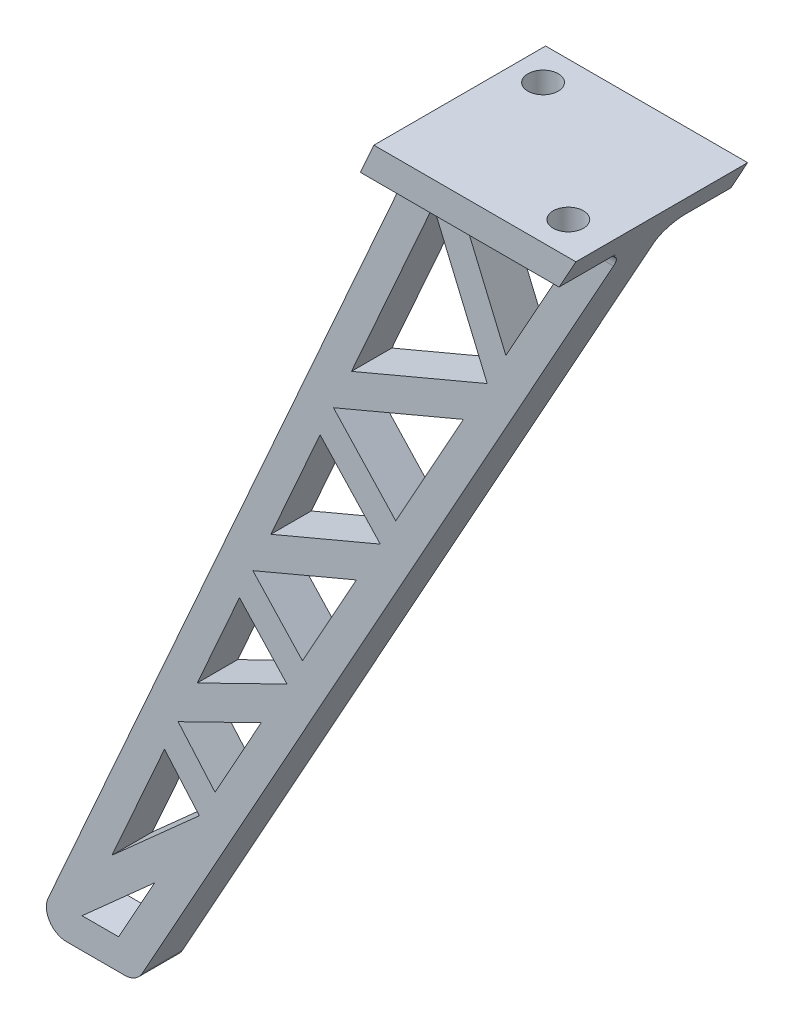
from build123d import *

# Parameters (mm, degrees)
BOSS_EXTRUDE1_DEPTH             = 4
SKETCH2_W                       = 20
SKETCH2_H                       = 17
BOSS_EXTRUDE2_DEPTH             = 3
CUT_EXTRUDE1_DEPTH              = 104.490337713
CUT_EXTRUDE1_DEPTH_BACK         = 104.490337713
BOSS_EXTRUDE3_REACH             = 105.49
BOSS_EXTRUDE3_DIRECTION_2_REACH = 105.49
FILLET2_START                   = -12.222222222
FILLET2_DEPTH                   = 20.555555555
FILLET2_START_2                 = -6.5
FILLET2_2_DEPTH                 = 17
CUT_EXTRUDE2_DEPTH              = 104.490337713
CUT_EXTRUDE2_DEPTH_BACK         = 104.490337713
SKETCH4_R                       = 1.5
FILLET1_R                       = 2
SKETCH8_R                       = 3.25
CUT_EXTRUDE5_DEPTH              = 2


with BuildPart() as part:
    # Sketch1 → Boss-Extrude1 (new body)
    with BuildSketch(Plane.XY):
        Polygon((-10, 0), (10, 0), (-40, -90), (-50, -90), align=None)
        Polygon((-8.939269622, -5), (3.790345509, -5), (-3.431876714, -18), align=None, mode=Mode.SUBTRACT)
        Polygon((-10.607355622, -8.753193502), (-18.717047399, -27), (-5.280384607, -21.327314208), align=None, mode=Mode.SUBTRACT)
        Polygon((-7.643825511, -25.581507835), (-14.336143532, -37.627680274), (-20.498621264, -31.008541196), align=None, mode=Mode.SUBTRACT)
        Polygon((-21.823082205, -33.988578312), (-26.698028096, -44.957206566), (-15.867976064, -40.384978831), align=None, mode=Mode.SUBTRACT)
        Polygon((-18.231416968, -44.639172459), (-23.566710848, -54.242701442), (-28.47960196, -48.965747762), align=None, mode=Mode.SUBTRACT)
        Polygon((-29.804062901, -51.945784878), (-33.981685193, -61.345435036), (-25.09854338, -57), align=None, mode=Mode.SUBTRACT)
        Polygon((-45.383714066, -87), (-41.765210047, -87), (-38.207091023, -80.595385758), align=None, mode=Mode.SUBTRACT)
        Polygon((-27.646340017, -61.586033947), (-32.225825485, -69.829107788), (-35.878360761, -65.612955064), align=None, mode=Mode.SUBTRACT)
        Polygon((-37.22421022, -68.641116347), (-42.421865314, -80.335840308), (-33.776674606, -72.620636206), align=None, mode=Mode.SUBTRACT)
    extrude(amount=BOSS_EXTRUDE1_DEPTH)

    # Sketch2 → Boss-Extrude2 (add)
    with BuildSketch(Plane(origin=(0, 0, 0), x_dir=(1, 0, 0), z_dir=(0, 1, 0))):
        with Locations((0, -2)):
            Rectangle(SKETCH2_W, SKETCH2_H)
    extrude(amount=-BOSS_EXTRUDE2_DEPTH)

    # Sketch3 → Cut-Extrude1 (cut, two sides: drawn at the far end of the back side and taken through both)
    with BuildSketch(Plane.XY.offset(4).offset(-CUT_EXTRUDE1_DEPTH_BACK)):
        Polygon((8.333333333, -3), (10, 0), (10, -3), align=None)
    extrude(amount=CUT_EXTRUDE1_DEPTH + CUT_EXTRUDE1_DEPTH_BACK, mode=Mode.SUBTRACT)

    # Boss-Extrude3: up to this face of the body (flat: up to its plane)
    boss_extrude3_end = Plane(part.part.faces().sort_by_distance((-0.410628019, -1.47826087, 10.5))[0])
    # Sketch7 → Boss-Extrude3 (add, up to the picked face)
    with BuildSketch(Plane.XY.offset(4), mode=Mode.PRIVATE) as boss_extrude3_sk1:
        Polygon((-10, -3), (-11.333333333, -3), (-10, 0), align=None)
    boss_extrude3_tool1 = split(extrude(boss_extrude3_sk1.sketch, amount=BOSS_EXTRUDE3_REACH, mode=Mode.PRIVATE), bisect_by=boss_extrude3_end, keep=Keep.BOTH, mode=Mode.PRIVATE)
    add(boss_extrude3_tool1.solids().sort_by(Axis((-10.444444, -2, 4), (0, 0, 1)))[0])

    # Boss-Extrude3 direction 2: up to this face of the body (flat: up to its plane)
    boss_extrude3_direction_2_end = Plane(part.part.faces().sort_by_distance((-0.410628019, -1.47826087, -6.5))[0])
    # Sketch7 → Boss-Extrude3 direction 2 (add, up to the picked face)
    with BuildSketch(Plane.XY.offset(4), mode=Mode.PRIVATE) as boss_extrude3_direction_2_sk1:
        Polygon((-10, -3), (-11.333333333, -3), (-10, 0), align=None)
    boss_extrude3_direction_2_tool1 = split(extrude(boss_extrude3_direction_2_sk1.sketch, amount=-BOSS_EXTRUDE3_DIRECTION_2_REACH, mode=Mode.PRIVATE), bisect_by=boss_extrude3_direction_2_end, keep=Keep.BOTH, mode=Mode.PRIVATE)
    add(boss_extrude3_direction_2_tool1.solids().sort_by(Axis((-10.444444, -2, 4), (0, 0, -1)))[0])

    # Fillet2: read off the stored shape, not the designer's step
    # Fillet2 outline → Fillet2 (add)
    with BuildSketch(Plane.YZ.offset(FILLET2_START)):
        with BuildLine():
            Line((-3, 4), (-3, 6))
            ThreePointArc((-3, 6), (-3.585786438, 4.585786438), (-5, 4))
            Line((-5, 4), (-3, 4))
        make_face()
        with BuildLine():
            ThreePointArc((-5, 0), (-3.585786438, -0.585786438), (-3, -2))
            Line((-3, -2), (-3, 0))
            Line((-3, 0), (-5, 0))
        make_face()
    extrude(amount=FILLET2_DEPTH)

    # Fillet2 2 outline → Fillet2 2 (cut)
    with BuildSketch(Plane.XY.offset(FILLET2_START_2)):
        Polygon((10, -1), (9.444444444, -1), (8.333333333, -3), (6.666666667, -6), (10, -6), align=None)
        Polygon((-12.222222222, -5), (-11.333333333, -3), (-12.222222222, -3), align=None)
    extrude(amount=FILLET2_2_DEPTH, mode=Mode.SUBTRACT)

    # Sketch4 → Cut-Extrude2 (cut, two sides: drawn at the far end of the back side and taken through both)
    with BuildSketch(Plane(origin=(0, 0, 0), x_dir=(1, 0, 0), z_dir=(0, 1, 0)).offset(-CUT_EXTRUDE2_DEPTH_BACK)):
        with Locations(Location((-7, 3.25, 0), (0, 0, 236.442690238))):
            Circle(SKETCH4_R)
        with Locations(Location((6, -7.25, 0), (0, 0, 123.557309765))):
            Circle(SKETCH4_R)
    extrude(amount=CUT_EXTRUDE2_DEPTH + CUT_EXTRUDE2_DEPTH_BACK, mode=Mode.SUBTRACT)

    # Fillet1
    fillet1_edges = [part.edges().sort_by_distance(p)[0] for p in [
        (-40, -90, 2),
        (-50, -90, 2),
    ]]
    fillet(fillet1_edges, radius=FILLET1_R)

    # Sketch8 → Cut-Extrude5 (cut)
    with BuildSketch(Plane.XZ.offset(3)):
        with Locations((-7, -3.25)):
            Circle(SKETCH8_R)
        with Locations((6, 7.25)):
            Circle(SKETCH8_R)
    extrude(amount=CUT_EXTRUDE5_DEPTH, mode=Mode.SUBTRACT)


solid = part.part
